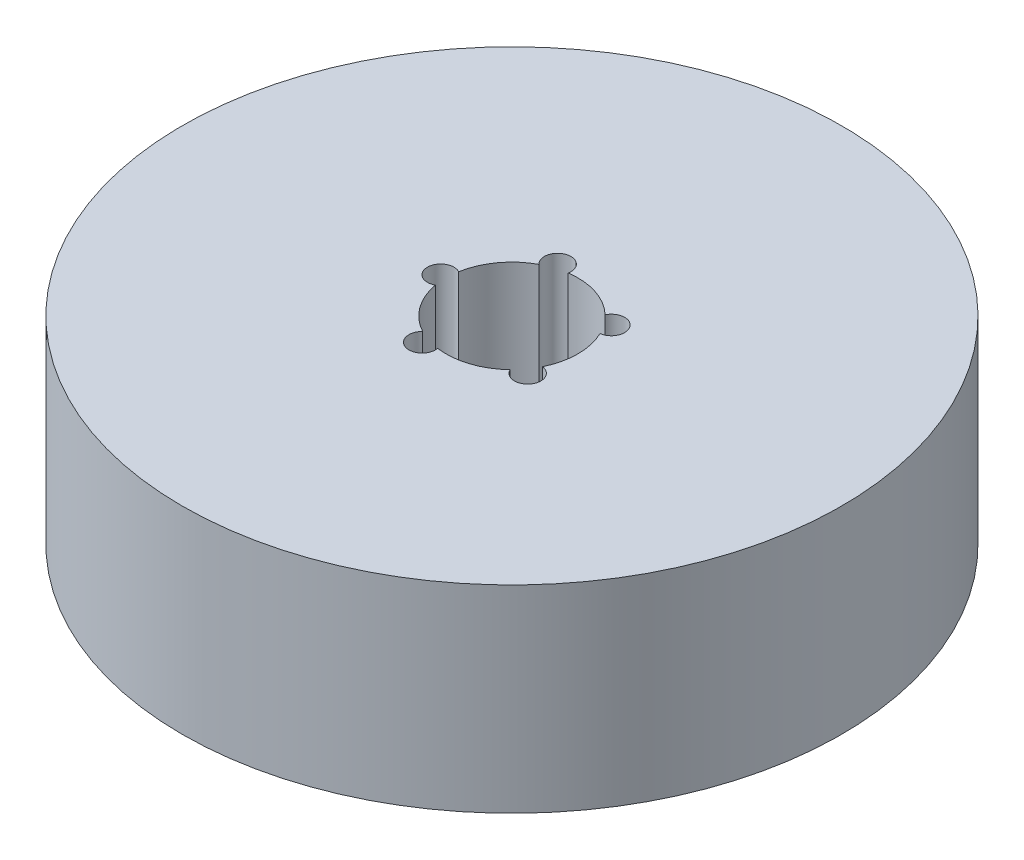
from build123d import *

# Parameters (mm, degrees)
SKETCH1_R           = 50
BOSS_EXTRUDE1_DEPTH = 30
SKETCH2_R           = 10
CUT_EXTRUDE1_DEPTH  = 77.811457479
SKETCH3_R           = 2.009003391
CUT_EXTRUDE2_DEPTH  = 25.147383577
CIRPATTERN1_COUNT   = 5


with BuildPart() as part:
    # Sketch1 → Boss-Extrude1 (new body)
    with BuildSketch(Plane(origin=(0, 0, 0), x_dir=(1, 0, 0), z_dir=(0, 1, 0))):
        Circle(SKETCH1_R)
    extrude(amount=BOSS_EXTRUDE1_DEPTH)

    # Sketch2 → Cut-Extrude1 (cut, through all)
    with BuildSketch(Plane(origin=(0, 0, 0), x_dir=(1, 0, 0), z_dir=(0, 1, 0))):
        Circle(SKETCH2_R)
    extrude(amount=CUT_EXTRUDE1_DEPTH, mode=Mode.SUBTRACT)

    # Sketch3 → Cut-Extrude2 (cut)
    with BuildSketch(Plane(origin=(0, 30, 0), x_dir=(1, 0, 0), z_dir=(0, 1, 0))):
        with Locations((-10.804236781, 0)):
            Circle(SKETCH3_R)
    cut_extrude2 = extrude(amount=-CUT_EXTRUDE2_DEPTH, mode=Mode.SUBTRACT)

    # CirPattern1: Cut-Extrude2 ×5 about axis
    cirpattern1_axis = Axis((0, 0, 0), (0, 1, 0))
    for i in range(1, CIRPATTERN1_COUNT):
        add(cut_extrude2.rotate(cirpattern1_axis, i * 360 / CIRPATTERN1_COUNT), mode=Mode.SUBTRACT)


solid = part.part
